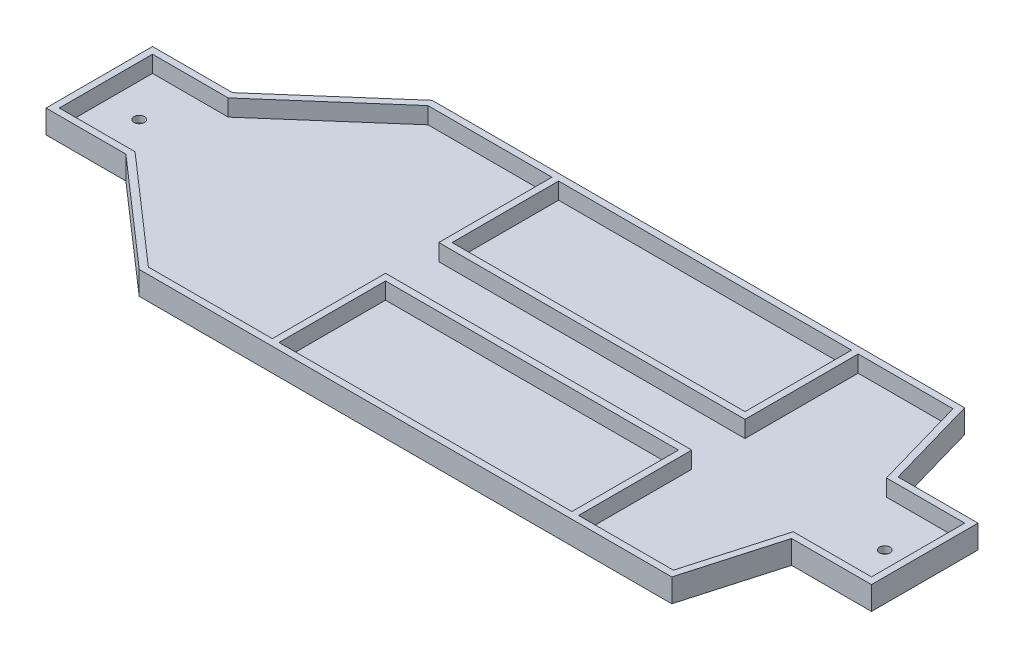
from build123d import *

# Parameters (mm, degrees)
SKETCH1_R           = 2.4892
BOSS_EXTRUDE1_DEPTH = 3.175
SKETCH1_3_W         = 139.7
SKETCH1_3_H         = 50.8
BOSS_EXTRUDE2_DEPTH = 11.1125


with BuildPart() as part:
    # Sketch1 → Boss-Extrude1 (new body)
    with BuildSketch(Plane(origin=(0, 0, 0), x_dir=(1, 0, 0), z_dir=(0, 1, 0))):
        Polygon((-127, 69.85), (-177.8, 25.4), (-215.9, 25.4), (-215.9, -25.4), (-177.8, -25.4), (-127, -69.85), (127, -69.85), (139.7, -25.4), (177.8, -25.4), (177.8, 25.4), (139.7, 25.4), (127, 69.85), align=None)
        with Locations((-196.85, 0)):
            Circle(SKETCH1_R, mode=Mode.SUBTRACT)
        with Locations((158.75, 0)):
            Circle(SKETCH1_R, mode=Mode.SUBTRACT)
    extrude(amount=BOSS_EXTRUDE1_DEPTH)

    # Sketch1<3> → Boss-Extrude2 (add)
    with BuildSketch(Plane(origin=(0, 0, 0), x_dir=(1, 0, 0), z_dir=(0, 1, 0))):
        Polygon((-127, 69.85), (-177.8, 25.4), (-215.9, 25.4), (-215.9, -25.4), (-177.8, -25.4), (-127, -69.85), (127, -69.85), (139.7, -25.4), (177.8, -25.4), (177.8, 25.4), (139.7, 25.4), (127, 69.85), align=None)
        Polygon((-125.807041006, 66.675), (-66.675, 66.675), (-66.675, 12.7), (79.375, 12.7), (79.375, 66.675), (124.605093015, 66.675), (137.305093015, 22.225), (174.625, 22.225), (174.625, -22.225), (137.305093015, -22.225), (124.605093015, -66.675), (79.375, -66.675), (79.375, -12.7), (-66.675, -12.7), (-66.675, -66.675), (-125.807041006, -66.675), (-176.607041006, -22.225), (-212.725, -22.225), (-212.725, 22.225), (-176.607041006, 22.225), align=None, mode=Mode.SUBTRACT)
        with Locations((6.35, 41.275)):
            Rectangle(SKETCH1_3_W, SKETCH1_3_H, mode=Mode.SUBTRACT)
        with Locations((6.35, -41.275)):
            Rectangle(SKETCH1_3_W, SKETCH1_3_H, mode=Mode.SUBTRACT)
    extrude(amount=BOSS_EXTRUDE2_DEPTH)


solid = part.part
